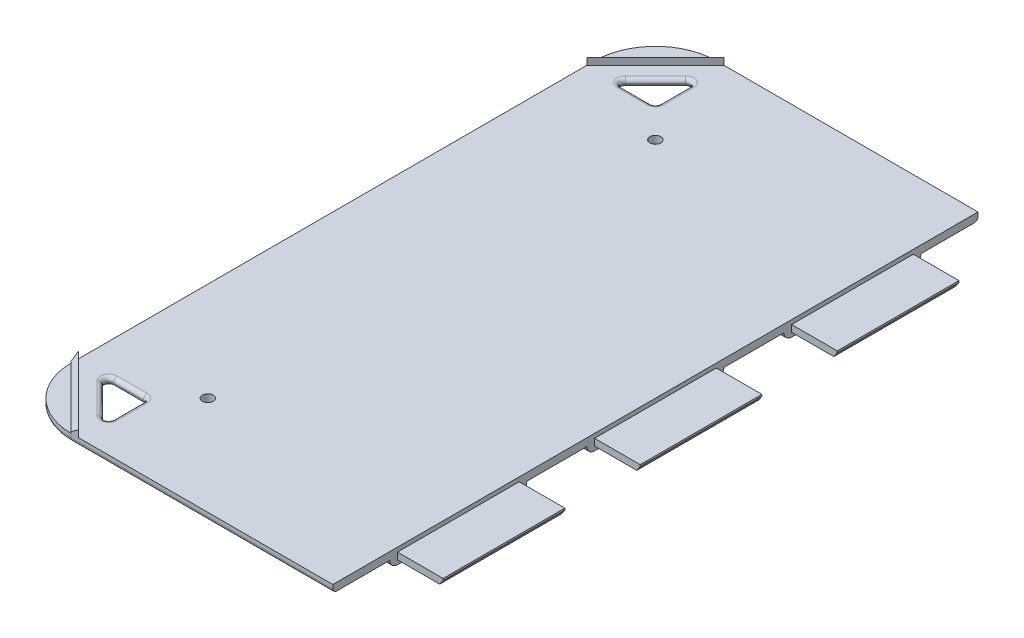
from build123d import *
from OCP.BRepFilletAPI import BRepFilletAPI_MakeChamfer

# Parameters (mm, degrees)
SKETCH1_W           = 134.62
SKETCH1_H           = 269.24
BOSS_EXTRUDE1_DEPTH = 3.175
BOSS_EXTRUDE2_DEPTH = 3.175
CUT_EXTRUDE1_REACH  = 192.408
SKETCH2_3_R         = 2.286
CHAMFER1_SIZE       = 2.54
FILLET1_R           = 1.905
FILLET2_R           = 1.5875
FILLET3_R           = 25.4
FILLET4_R           = 1.5875
SKETCH3_W           = 31.75
SKETCH3_H           = 57.15
BOSS_EXTRUDE3_DEPTH = 3.175
SKETCH4_W           = 50.8
SKETCH4_H           = 2.794
BOSS_EXTRUDE4_DEPTH = 19.05
FILLET5_R           = 12.7
FILLET6_R           = 3.175
CHAMFER2_SIZE       = 2.032
CHAMFER2_SIZE2      = 1.422821718


# Some blends are built 0.0001 mm under size
with BuildPart() as part:
    # Sketch1 → Boss-Extrude1 (new body)
    with BuildSketch(Plane(origin=(0, 0, 0), x_dir=(1, 0, 0), z_dir=(0, 1, 0))):
        with Locations((-67.31, 0)):
            Rectangle(SKETCH1_W, SKETCH1_H)
    extrude(amount=BOSS_EXTRUDE1_DEPTH)

    # Sketch2 → Boss-Extrude2 (add)
    with BuildSketch(Plane(origin=(0, 3.175, 0), x_dir=(1, 0, 0), z_dir=(0, 1, 0))):
        Polygon((-134.62, 109.22), (-134.62, 106.045), (-120.3325, 120.3325), (-106.045, 134.62), (-109.22, 134.62), align=None)
        Polygon((-134.62, -109.22), (-109.22, -134.62), (-106.045, -134.62), (-120.3325, -120.3325), (-134.62, -106.045), align=None)
    extrude(amount=BOSS_EXTRUDE2_DEPTH)

    # Sketch2<3> → Cut-Extrude1 (cut, up to next)
    with BuildSketch(Plane(origin=(0, 3.175, 0), x_dir=(1, 0, 0), z_dir=(0, 1, 0)), mode=Mode.PRIVATE) as cut_extrude1_sk1:
        with Locations(Location((-93.391731637, 93.391731637, 0), (0, 0, 270))):
            Circle(SKETCH2_3_R)
    cut_extrude1_tool1 = extrude(cut_extrude1_sk1.sketch, amount=-CUT_EXTRUDE1_REACH, mode=Mode.PRIVATE) & part.part
    # Sketch2<3> → Cut-Extrude1 (cut, up to next)
    with BuildSketch(Plane(origin=(0, 3.175, 0), x_dir=(1, 0, 0), z_dir=(0, 1, 0)), mode=Mode.PRIVATE) as cut_extrude1_sk2:
        with Locations(Location((-93.391731637, -93.391731637, 0), (0, 0, 270))):
            Circle(SKETCH2_3_R)
    cut_extrude1_tool2 = extrude(cut_extrude1_sk2.sketch, amount=-CUT_EXTRUDE1_REACH, mode=Mode.PRIVATE) & part.part
    # Sketch2<3> → Cut-Extrude1 (cut, up to next)
    with BuildSketch(Plane(origin=(0, 3.175, 0), x_dir=(1, 0, 0), z_dir=(0, 1, 0)), mode=Mode.PRIVATE) as cut_extrude1_sk3:
        Polygon((-124.918359133, -105.868359133), (-105.868359133, -124.918359133), (-105.868359133, -105.868359133), align=None)
    cut_extrude1_tool3 = extrude(cut_extrude1_sk3.sketch, amount=-CUT_EXTRUDE1_REACH, mode=Mode.PRIVATE) & part.part
    # Sketch2<3> → Cut-Extrude1 (cut, up to next)
    with BuildSketch(Plane(origin=(0, 3.175, 0), x_dir=(1, 0, 0), z_dir=(0, 1, 0)), mode=Mode.PRIVATE) as cut_extrude1_sk4:
        Polygon((-124.918359133, 105.868359133), (-105.868359133, 124.918359133), (-105.868359133, 105.868359133), align=None)
    cut_extrude1_tool4 = extrude(cut_extrude1_sk4.sketch, amount=-CUT_EXTRUDE1_REACH, mode=Mode.PRIVATE) & part.part
    add(cut_extrude1_tool1.solids().sort_by_distance((-93.391732, 3.175, -93.391732))[0], mode=Mode.SUBTRACT)
    add(cut_extrude1_tool2.solids().sort_by_distance((-93.391732, 3.175, 93.391732))[0], mode=Mode.SUBTRACT)
    add(cut_extrude1_tool3.solids().sort_by_distance((-112.218359, 3.175, 112.218359))[0], mode=Mode.SUBTRACT)
    add(cut_extrude1_tool4.solids().sort_by_distance((-112.218359, 3.175, -112.218359))[0], mode=Mode.SUBTRACT)

    # Chamfer1
    # the kernel refuses this chamfer: 2.54 mm, written as the material it takes off along each edge
    with BuildSketch(Plane(origin=(-104.601125621, 6.35, -139.238874379), x_dir=(0.7068394360706735, 0.027495876610586185, 0.7068394360706735), z_dir=(-0.7071067811865476, 0, 0.7071067811865476))) as chamfer1_piece_1:
        Polygon((CHAMFER1_SIZE * 0.999621916911, -CHAMFER1_SIZE * 0.0274958766106), (-CHAMFER1_SIZE * 0.0274958766106, -CHAMFER1_SIZE * 0.999621916911), (0, 0), align=None)
    extrude(amount=48.985174063, mode=Mode.SUBTRACT)
    with BuildSketch(Plane(origin=(-139.238874379, 6.35, 104.601125621), x_dir=(-0.019442520806012394, -0.9996219169112968, 0.019442520806012414), z_dir=(0.7071067811865479, 0, 0.7071067811865471))) as chamfer1_piece_2:
        Polygon((CHAMFER1_SIZE * 0.999621916911, CHAMFER1_SIZE * 0.0274958766106), (-CHAMFER1_SIZE * 0.0274958766106, CHAMFER1_SIZE * 0.999621916911), (0, 0), align=None)
    extrude(amount=48.985174063, mode=Mode.SUBTRACT)

    # Fillet1
    fillet1_edges = [part.edges().sort_by_distance(p)[0] for p in [
        (-105.868359133, 1.5875, -124.918359133),
        (-105.868359133, 1.5875, -105.868359133),
        (-124.918359133, 1.5875, -105.868359133),
        (-105.868359133, 1.5875, 124.918359133),
        (-124.918359133, 1.5875, 105.868359133),
        (-105.868359133, 1.5875, 105.868359133),
    ]]
    fillet(fillet1_edges, radius=FILLET1_R)

    # Fillet2
    fillet2_edges = [part.edges().sort_by_distance(p)[0] for p in [
        (-107.044347195, 0, 122.079272807),
        (-105.868359133, 0, 114.046320715),
        (-106.426320715, 0, 106.426320715),
        (-114.046320715, 0, 105.868359133),
        (-122.079272807, 0, 107.044347195),
        (-122.079272807, 3.175, 107.044347195),
        (-114.046320715, 3.175, 105.868359133),
        (-106.426320715, 3.175, 106.426320715),
        (-105.868359133, 3.175, 114.046320715),
        (-107.044347195, 3.175, 122.079272807),
        (-122.079272807, 3.175, -107.044347195),
        (-114.046320715, 3.175, -105.868359133),
        (-106.426320715, 3.175, -106.426320715),
        (-105.868359133, 3.175, -114.046320715),
        (-107.044347195, 3.175, -122.079272807),
        (-107.044347195, 0, -122.079272807),
        (-105.868359133, 0, -114.046320715),
        (-106.426320715, 0, -106.426320715),
        (-114.046320715, 0, -105.868359133),
        (-122.079272807, 0, -107.044347195),
        (-115.393359133, 0, 115.393359133),
        (-115.393359133, 3.175, 115.393359133),
        (-115.393359133, 3.175, -115.393359133),
        (-115.393359133, 0, -115.393359133),
    ]]
    fillet(fillet2_edges, radius=FILLET2_R - 0.0001)  # a hair under: the kernel refuses the full size

    # Fillet3
    fillet3_edges = [part.edges().sort_by_distance(p)[0] for p in [
        (-134.62, 1.5875, 134.62),
        (-134.62, 1.5875, -134.62),
    ]]
    fillet(fillet3_edges, radius=FILLET3_R)

    # Fillet4
    fillet4_edges = [part.edges().sort_by_distance(p)[0] for p in [
        (-54.61, 0, 134.62),
        (-54.61, 0, -134.62),
        (-134.62, 0, 0),
        (-127.180512242, 0, -127.180512242),
        (-127.180512242, 0, 127.180512242),
    ]]
    fillet(fillet4_edges, radius=FILLET4_R)

    # Sketch3 → Boss-Extrude3 (add)
    with BuildSketch(Plane.XZ):
        with Locations((-15.875, 82.2325)):
            Rectangle(SKETCH3_W, SKETCH3_H)
        with Locations((-15.875, 0)):
            Rectangle(SKETCH3_W, SKETCH3_H)
        with Locations((-15.875, -82.2325)):
            Rectangle(SKETCH3_W, SKETCH3_H)
    extrude(amount=BOSS_EXTRUDE3_DEPTH)

    # Sketch4 → Boss-Extrude4 (add)
    with BuildSketch(Plane(origin=(0, 0, 0), x_dir=(0, 0, -1), z_dir=(1, 0, 0))):
        with Locations((-82.2325, 0)):
            Rectangle(SKETCH4_W, SKETCH4_H)
        Rectangle(SKETCH4_W, SKETCH4_H)
        with Locations((82.2325, 0)):
            Rectangle(SKETCH4_W, SKETCH4_H)
    extrude(amount=BOSS_EXTRUDE4_DEPTH)

    # Fillet5
    fillet5_edges = [part.edges().sort_by_distance(p)[0] for p in [
        (-31.75, -1.5875, 110.8075),
        (-31.75, -1.5875, 53.6575),
        (-31.75, -1.5875, 28.575),
        (-31.75, -1.5875, -28.575),
        (-31.75, -1.5875, -53.6575),
        (-31.75, -1.5875, -110.8075),
    ]]
    fillet(fillet5_edges, radius=FILLET5_R)

    # Fillet6
    fillet6_edges = [part.edges().sort_by_distance(p)[0] for p in [
        (-9.525, -3.175, -53.6575),
        (-28.030256121, -3.175, -57.377243879),
        (-31.75, -3.175, -82.2325),
        (-28.030256121, -3.175, -107.087756121),
        (-9.525, -3.175, 28.575),
        (-28.030256121, -3.175, 24.855256121),
        (-31.75, -3.175, 0),
        (-28.030256121, -3.175, -24.855256121),
        (-9.525, -3.175, 110.8075),
        (-28.030256121, -3.175, 107.087756121),
        (-31.75, -3.175, 82.2325),
        (-28.030256121, -3.175, 57.377243879),
        (-9.525, -3.175, -110.8075),
        (-9.525, -3.175, -28.575),
        (-9.525, -3.175, 53.6575),
    ]]
    fillet(fillet6_edges, radius=FILLET6_R - 0.0001)  # a hair under: the kernel refuses the full size

    # Chamfer2: one chamfer whose edges measure the first distance from different faces: ONE call of the kernel's chamfer builder (chamfer() names one face for all edges)
    chamfer2_edges_1 = [part.edges().sort_by_distance(p)[0] for p in [
        (19.05, -1.397, 82.2325),
    ]]
    chamfer2_side_1 = [part.faces().sort_by_distance(p)[0] for p in [
        (19.05, 0, 82.2325),
    ]]
    chamfer2_edges_2 = [part.edges().sort_by_distance(p)[0] for p in [
        (19.05, -1.397, 0),
    ]]
    chamfer2_side_2 = [part.faces().sort_by_distance(p)[0] for p in [
        (19.05, 0, 0),
    ]]
    chamfer2_edges_3 = [part.edges().sort_by_distance(p)[0] for p in [
        (19.05, -1.397, -82.2325),
    ]]
    chamfer2_side_3 = [part.faces().sort_by_distance(p)[0] for p in [
        (19.05, 0, -82.2325),
    ]]
    chamfer2 = BRepFilletAPI_MakeChamfer(part.part.solid().wrapped)
    for e in chamfer2_edges_1:
        chamfer2.Add(CHAMFER2_SIZE, CHAMFER2_SIZE2, e.wrapped, chamfer2_side_1[0].wrapped)  # the first distance lies on this face
    for e in chamfer2_edges_2:
        chamfer2.Add(CHAMFER2_SIZE, CHAMFER2_SIZE2, e.wrapped, chamfer2_side_2[0].wrapped)  # the first distance lies on this face
    for e in chamfer2_edges_3:
        chamfer2.Add(CHAMFER2_SIZE, CHAMFER2_SIZE2, e.wrapped, chamfer2_side_3[0].wrapped)  # the first distance lies on this face
    add(Compound.cast(chamfer2.Shape()), mode=Mode.REPLACE)


solid = part.part
